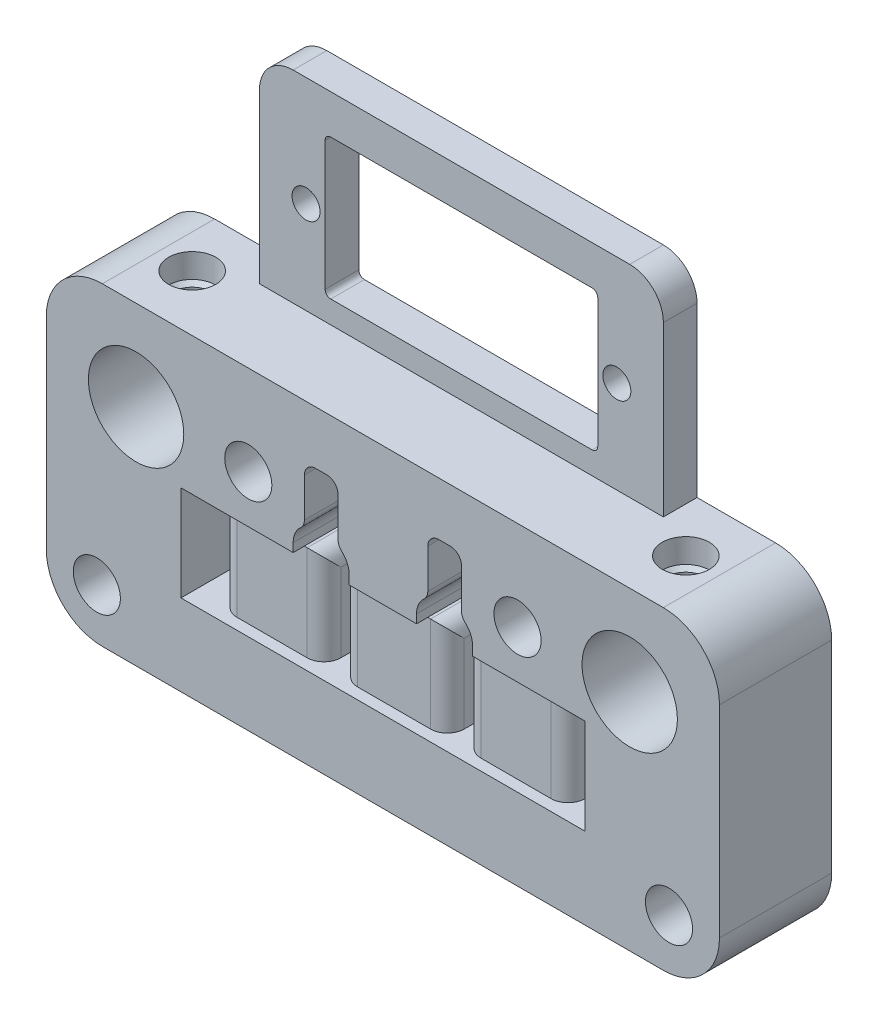
from build123d import *

# Parameters (mm, degrees)
SKETCH1_W           = 60
SKETCH1_H           = 28
SKETCH1_R           = 4.25
BOSS_EXTRUDE1_DEPTH = 5
CUT_EXTRUDE1_DEPTH  = 35.583232932
CUT_EXTRUDE2_REACH  = 43.34
SKETCH3_R           = 1.75
FILLET1_R           = 5
FILLET2_R           = 2
SKETCH4_R           = 1.25
BOSS_EXTRUDE2_DEPTH = 3
SKETCH5_W           = 3.75
SKETCH5_H           = 8.5
SKETCH5_W_2         = 9.5
BOSS_EXTRUDE4_DEPTH = 10
SKETCH6_W           = 36
SKETCH6_H           = 8.5
CUT_EXTRUDE3_DEPTH  = 1
SKETCH7_R           = 1.75
CUT_EXTRUDE4_DEPTH  = 45.988887539
SKETCH8_R           = 2.1
CUT_EXTRUDE5_DEPTH  = 4
SKETCH9_R           = 2.1
CUT_EXTRUDE6_DEPTH  = 2
CHAMFER1_SIZE       = 0.5
CUT_EXTRUDE7_REACH  = 46.777
SKETCH10_W          = 2.5
SKETCH10_H          = 8.5
FILLET3_R           = 1.5
FILLET4_R           = 1


with BuildPart() as part:
    # Sketch1 → Boss-Extrude1 (new, symmetric)
    with BuildSketch(Plane.XY):
        Rectangle(SKETCH1_W, SKETCH1_H)
        with Locations((-22, 6)):
            Circle(SKETCH1_R, mode=Mode.SUBTRACT)
        with Locations((22, 6)):
            Circle(SKETCH1_R, mode=Mode.SUBTRACT)
    extrude(amount=BOSS_EXTRUDE1_DEPTH, both=True)

    # Sketch2 → Cut-Extrude1 (cut, through all)
    with BuildSketch(Plane(origin=(0, 0, -5), x_dir=(-1, 0, 0), z_dir=(0, 0, -1))):
        Polygon((8, -6.75), (3, -6.75), (3, 4.25), (4, 4.25), (4, 9.25), (7, 9.25), (7, 4.25), (8, 4.25), align=None)
        Polygon((-8, -6.75), (-8, 4.25), (-7, 4.25), (-7, 9.25), (-4, 9.25), (-4, 4.25), (-3, 4.25), (-3, -6.75), align=None)
    extrude(amount=-CUT_EXTRUDE1_DEPTH, mode=Mode.SUBTRACT)

    # Sketch3 → Cut-Extrude2 (cut, up to next)
    with BuildSketch(Plane(origin=(0, 14, 0), x_dir=(1, 0, 0), z_dir=(0, 1, 0)), mode=Mode.PRIVATE) as cut_extrude2_sk1:
        with Locations(Location((-22, 0, 0), (0, 0, 270))):
            Circle(SKETCH3_R)
    cut_extrude2_tool1 = extrude(cut_extrude2_sk1.sketch, amount=-CUT_EXTRUDE2_REACH, mode=Mode.PRIVATE) & part.part
    # Sketch3 → Cut-Extrude2 (cut, up to next)
    with BuildSketch(Plane(origin=(0, 14, 0), x_dir=(1, 0, 0), z_dir=(0, 1, 0)), mode=Mode.PRIVATE) as cut_extrude2_sk2:
        with Locations(Location((22, 0, 0), (0, 0, 270))):
            Circle(SKETCH3_R)
    cut_extrude2_tool2 = extrude(cut_extrude2_sk2.sketch, amount=-CUT_EXTRUDE2_REACH, mode=Mode.PRIVATE) & part.part
    add(cut_extrude2_tool1.solids().sort_by_distance((-22, 14, 0))[0], mode=Mode.SUBTRACT)
    add(cut_extrude2_tool2.solids().sort_by_distance((22, 14, 0))[0], mode=Mode.SUBTRACT)

    # Fillet1
    fillet1_edges = [part.edges().sort_by_distance(p)[0] for p in [
        (-30, 14, 0),
        (30, 14, 0),
        (30, -14, 0),
        (-30, -14, 0),
    ]]
    fillet(fillet1_edges, radius=FILLET1_R)

    # Fillet2
    # the kernel refuses this fillet: 2 mm, written as the material it adds along each edge
    with BuildSketch(Plane(origin=(-8, 4.25, -5), x_dir=(0, -1, 0), z_dir=(0, 0, 1)), Plane(origin=(3, 4.25, -5), x_dir=(0, -1, 0), z_dir=(0, 0, 1))) as fillet2_piece_1:
        with BuildLine():
            CenterArc((1.732050808, 2), FILLET2_R, 210, 60)
            Line((0, 1), (-0.034641016, 0.98))
            ThreePointArc((-0.034641016, 0.98), (-0.04, 0.5), (-0.04, 0))
            Line((-0.04, 0), (0, -0.04))
            Line((0, -0.04), (1.732050808, -0.04))
            Line((1.732050808, -0.04), (1.732050808, 0))
        make_face()
    extrude(amount=10)
    with BuildSketch(Plane(origin=(-3, 4.25, -5), x_dir=(-1, 0, 0), z_dir=(0, 0, 1)), Plane(origin=(8, 4.25, -5), x_dir=(-1, 0, 0), z_dir=(0, 0, 1))) as fillet2_piece_2:
        with BuildLine():
            CenterArc((2, 1.732050808), FILLET2_R, 180, 60)
            Line((0, 1.732050808), (-0.04, 1.732050808))
            Line((-0.04, 1.732050808), (-0.04, 0))
            Line((-0.04, 0), (0, -0.04))
            ThreePointArc((0, -0.04), (0.5, -0.04), (0.98, -0.034641016))
            Line((0.98, -0.034641016), (1, 0))
        make_face()
    extrude(amount=10)

    # Sketch4 → Boss-Extrude2 (add)
    with BuildSketch(Plane(origin=(0, 0, -5), x_dir=(-1, 0, 0), z_dir=(0, 0, -1))):
        with BuildLine():
            Line((-18, 14), (18, 14))
            Line((18, 14), (18, 29))
            ThreePointArc((18, 29), (17.121320344, 31.121320344), (15, 32))
            Line((15, 32), (-15, 32))
            ThreePointArc((-15, 32), (-17.121320344, 31.121320344), (-18, 29))
            Line((-18, 29), (-18, 14))
        make_face()
        with Locations((-13.85, 22.25)):
            Circle(SKETCH4_R, mode=Mode.SUBTRACT)
        with Locations((13.85, 22.25)):
            Circle(SKETCH4_R, mode=Mode.SUBTRACT)
        with BuildLine():
            Line((-11.65, 28.5), (11.65, 28.5))
            ThreePointArc((11.65, 28.5), (12.003553391, 28.353553391), (12.15, 28))
            Line((12.15, 28), (12.15, 16.5))
            ThreePointArc((12.15, 16.5), (12.003553391, 16.146446609), (11.65, 16))
            Line((11.65, 16), (-11.65, 16))
            ThreePointArc((-11.65, 16), (-12.003553391, 16.146446609), (-12.15, 16.5))
            Line((-12.15, 16.5), (-12.15, 28))
            ThreePointArc((-12.15, 28), (-12.003553391, 28.353553391), (-11.65, 28.5))
        make_face(mode=Mode.SUBTRACT)
    extrude(amount=-BOSS_EXTRUDE2_DEPTH)

    # Sketch5 → Boss-Extrude4 (add)
    with BuildSketch(Plane.XY.offset(5)):
        with Locations((-8.125, -2.5)):
            Rectangle(SKETCH5_W, SKETCH5_H)
        with Locations((0, -2.5)):
            Rectangle(SKETCH5_W_2, SKETCH5_H)
        with Locations((8.125, -2.5)):
            Rectangle(SKETCH5_W, SKETCH5_H)
    extrude(amount=-BOSS_EXTRUDE4_DEPTH)

    # Sketch6 → Cut-Extrude3 (cut)
    with BuildSketch(Plane.XY.offset(5)):
        with Locations((0, -2.5)):
            Rectangle(SKETCH6_W, SKETCH6_H)
    extrude(amount=-CUT_EXTRUDE3_DEPTH, mode=Mode.SUBTRACT)

    # Sketch7 → Cut-Extrude4 (cut, through all)
    with BuildSketch(Plane.XY.offset(5)):
        with Locations((25.5, -9.5)):
            Circle(SKETCH7_R)
        with Locations((-25.5, -9.5)):
            Circle(SKETCH7_R)
        with Locations((-12, 6)):
            Circle(SKETCH7_R)
        with Locations((12, 6)):
            Circle(SKETCH7_R)
    extrude(amount=-CUT_EXTRUDE4_DEPTH, mode=Mode.SUBTRACT)

    # Sketch8 → Cut-Extrude5 (cut)
    with BuildSketch(Plane(origin=(0, 0, 5), x_dir=(-1, 0, 0), z_dir=(0, 0, -1))):
        with Locations((-12, 6)):
            Circle(SKETCH8_R)
        with Locations((-25.5, -9.5)):
            Circle(SKETCH8_R)
        with Locations((25.5, -9.5)):
            Circle(SKETCH8_R)
        with Locations((12, 6)):
            Circle(SKETCH8_R)
    extrude(amount=CUT_EXTRUDE5_DEPTH, mode=Mode.SUBTRACT)

    # Sketch9 → Cut-Extrude6 (cut)
    with BuildSketch(Plane.XZ.offset(-14)):
        with Locations(Location((-22, 0, 0), (0, 0, 270))):
            Circle(SKETCH9_R)
        with Locations(Location((22, 0, 0), (0, 0, 270))):
            Circle(SKETCH9_R)
    extrude(amount=CUT_EXTRUDE6_DEPTH, mode=Mode.SUBTRACT)

    # Chamfer1
    # the kernel refuses this chamfer: 0.5 mm, written as the material it takes off along each edge
    with BuildSketch(Plane(origin=(-25.5, -9.5, 1), x_dir=(1, 0, 0), z_dir=(0, -1, 0))) as chamfer1_piece_1_section:
        Polygon((1.75, -CHAMFER1_SIZE), (1.75 + CHAMFER1_SIZE, 0), (1.75, 0), align=None)
    chamfer1_piece_1 = revolve(axis=Axis((-25.5, -9.5, 1), (0, 0, 1)), mode=Mode.PRIVATE)
    chamfer1_piece_1 = chamfer1_piece_1 & Plane(origin=(-25.5, -9.5, 0.675956313), x_dir=(-1, 0, 0), z_dir=(0, 0, 1)) * Cylinder(2.1, 9, mode=Mode.PRIVATE)
    add(chamfer1_piece_1, mode=Mode.SUBTRACT)
    with BuildSketch(Plane(origin=(25.5, -9.5, 1), x_dir=(1, 0, 0), z_dir=(0, -1, 0))) as chamfer1_piece_2_section:
        Polygon((1.75, -CHAMFER1_SIZE), (1.75 + CHAMFER1_SIZE, 0), (1.75, 0), align=None)
    chamfer1_piece_2 = revolve(axis=Axis((25.5, -9.5, 1), (0, 0, 1)), mode=Mode.PRIVATE)
    chamfer1_piece_2 = chamfer1_piece_2 & Plane(origin=(25.5, -9.5, 0.675956313), x_dir=(-1, 0, 0), z_dir=(0, 0, 1)) * Cylinder(2.1, 9, mode=Mode.PRIVATE)
    add(chamfer1_piece_2, mode=Mode.SUBTRACT)
    with BuildSketch(Plane(origin=(-22, 12, 0), x_dir=(0, 0, 1), z_dir=(-1, 0, 0))) as chamfer1_piece_3_section:
        Polygon((1.75, -CHAMFER1_SIZE), (1.75 + CHAMFER1_SIZE, 0), (1.75, 0), align=None)
    chamfer1_piece_3 = revolve(axis=Axis((-22, 12, 0), (0, 1, 0)), mode=Mode.PRIVATE)
    chamfer1_piece_3 = chamfer1_piece_3 & Plane(origin=(-22, 11.675956313, 0), x_dir=(0, 0, -1), z_dir=(0, 1, 0)) * Cylinder(2.1, 9, mode=Mode.PRIVATE)
    add(chamfer1_piece_3, mode=Mode.SUBTRACT)
    with BuildSketch(Plane(origin=(22, 12, 0), x_dir=(0, 0, 1), z_dir=(-1, 0, 0))) as chamfer1_piece_4_section:
        Polygon((1.75, -CHAMFER1_SIZE), (1.75 + CHAMFER1_SIZE, 0), (1.75, 0), align=None)
    chamfer1_piece_4 = revolve(axis=Axis((22, 12, 0), (0, 1, 0)), mode=Mode.PRIVATE)
    chamfer1_piece_4 = chamfer1_piece_4 & Plane(origin=(22, 11.675956313, 0), x_dir=(0, 0, -1), z_dir=(0, 1, 0)) * Cylinder(2.1, 9, mode=Mode.PRIVATE)
    add(chamfer1_piece_4, mode=Mode.SUBTRACT)
    with BuildSketch(Plane(origin=(-12, 6, 1), x_dir=(1, 0, 0), z_dir=(0, -1, 0))) as chamfer1_piece_5_section:
        Polygon((1.75, -CHAMFER1_SIZE), (1.75 + CHAMFER1_SIZE, 0), (1.75, 0), align=None)
    chamfer1_piece_5 = revolve(axis=Axis((-12, 6, 1), (0, 0, 1)), mode=Mode.PRIVATE)
    chamfer1_piece_5 = chamfer1_piece_5 & Plane(origin=(-12, 6, 0.675956313), x_dir=(-1, 0, 0), z_dir=(0, 0, 1)) * Cylinder(2.1, 9, mode=Mode.PRIVATE)
    add(chamfer1_piece_5, mode=Mode.SUBTRACT)
    with BuildSketch(Plane(origin=(12, 6, 1), x_dir=(1, 0, 0), z_dir=(0, -1, 0))) as chamfer1_piece_6_section:
        Polygon((1.75, -CHAMFER1_SIZE), (1.75 + CHAMFER1_SIZE, 0), (1.75, 0), align=None)
    chamfer1_piece_6 = revolve(axis=Axis((12, 6, 1), (0, 0, 1)), mode=Mode.PRIVATE)
    chamfer1_piece_6 = chamfer1_piece_6 & Plane(origin=(12, 6, 0.675956313), x_dir=(-1, 0, 0), z_dir=(0, 0, 1)) * Cylinder(2.1, 9, mode=Mode.PRIVATE)
    add(chamfer1_piece_6, mode=Mode.SUBTRACT)

    # Sketch10 → Cut-Extrude7 (cut, up to next)
    with BuildSketch(Plane.XY.offset(4), mode=Mode.PRIVATE) as cut_extrude7_sk1:
        with Locations((-16.75, -2.5)):
            Rectangle(SKETCH10_W, SKETCH10_H)
    cut_extrude7_tool1 = extrude(cut_extrude7_sk1.sketch, amount=-CUT_EXTRUDE7_REACH, mode=Mode.PRIVATE) & part.part
    # Sketch10 → Cut-Extrude7 (cut, up to next)
    with BuildSketch(Plane.XY.offset(4), mode=Mode.PRIVATE) as cut_extrude7_sk2:
        with Locations((16.75, -2.5)):
            Rectangle(SKETCH10_W, SKETCH10_H)
    cut_extrude7_tool2 = extrude(cut_extrude7_sk2.sketch, amount=-CUT_EXTRUDE7_REACH, mode=Mode.PRIVATE) & part.part
    add(cut_extrude7_tool1.solids().sort_by_distance((-16.75, -2.5, 4))[0], mode=Mode.SUBTRACT)
    add(cut_extrude7_tool2.solids().sort_by_distance((16.75, -2.5, 4))[0], mode=Mode.SUBTRACT)

    # Fillet3
    fillet3_edges = [part.edges().sort_by_distance(p)[0] for p in [
        (-6.25, 1.75, -0.5),
        (-4.75, 1.75, -0.5),
        (4.75, 1.75, -0.5),
        (6.25, 1.75, -0.5),
        (6.25, -2.5, 4),
        (-6.25, -2.5, 4),
        (-4.75, -2.5, 4),
        (4.75, -2.5, 4),
        (-15.5, -2.5, 4),
        (15.5, -2.5, 4),
    ]]
    fillet(fillet3_edges, radius=FILLET3_R)

    # Fillet4
    fillet4_edges = [part.edges().sort_by_distance(p)[0] for p in [
        (-4, 4.25, 0),
        (-4, 9.25, 0),
        (-7, 9.25, 0),
        (-7, 4.25, 0),
        (7, 4.25, 0),
        (7, 9.25, 0),
        (4, 9.25, 0),
        (4, 4.25, 0),
    ]]
    fillet(fillet4_edges, radius=FILLET4_R)


solid = part.part
